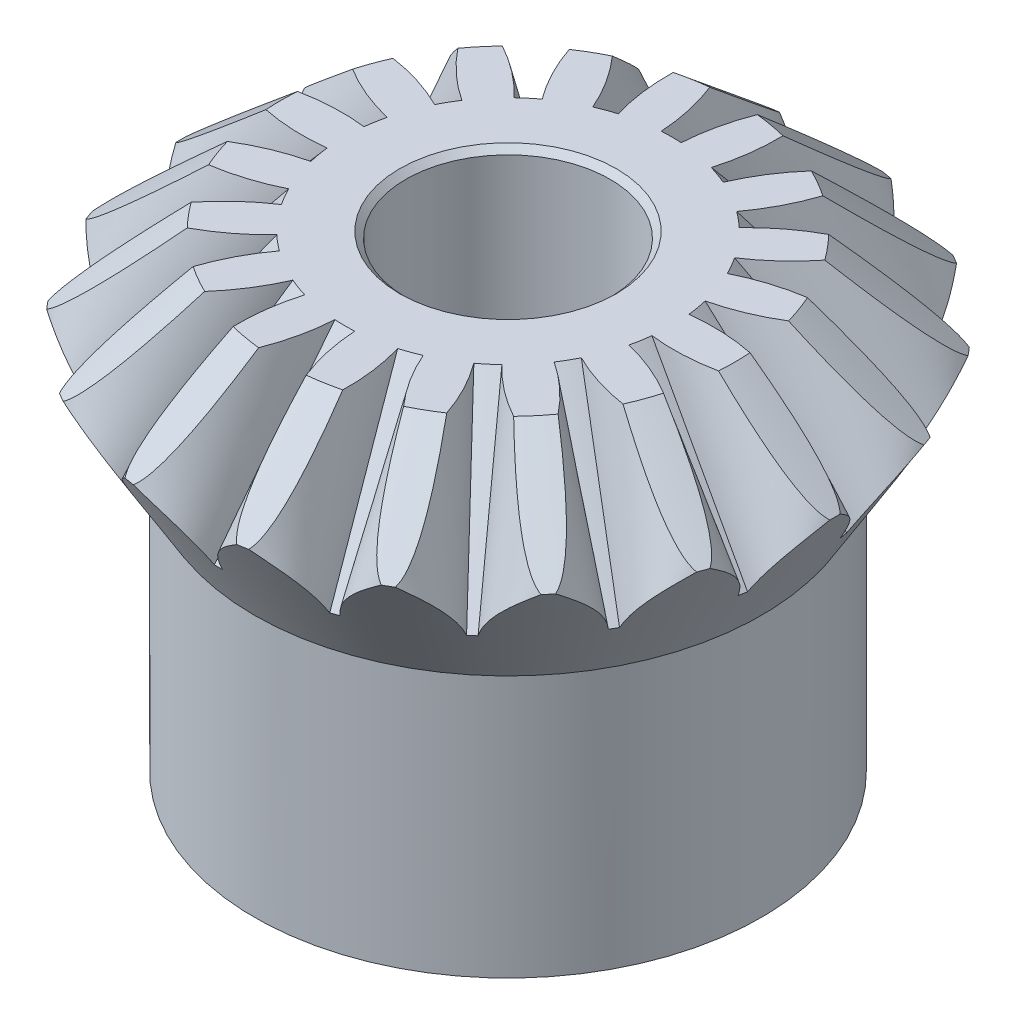
from build123d import *

# Parameters (mm, degrees)
CUT_EXTRUDE1_DEPTH      = 11.216863871
CUT_EXTRUDE1_DEPTH_BACK = 11.216863871
SKETCH4_R               = 1.5875
CIRPATTERN2_COUNT       = 18
CHAMFER1_SIZE           = 0.09525


with BuildPart() as part:
    # Sketch3 → Revolve1 (revolve)
    with BuildSketch(Plane(origin=(0, 0, 0), x_dir=(0, 0, -1), z_dir=(1, 0, 0))):
        Polygon((0, 3.6322), (-3.523397692, 3.6322), (-5.08, 2.326055577), (-3.937, 0.4318), (-3.937, -3.6322), (0, -3.6322), align=None)
    revolve(axis=Axis((0, -3.6322, 0), (0, 1, 0)))

    # Sketch4 → Cut-Extrude1 (cut, two sides: drawn at the far end of the back side and taken through both)
    with BuildSketch(Plane(origin=(0, 3.6322, 0), x_dir=(1, 0, 0), z_dir=(0, 1, 0)).offset(-CUT_EXTRUDE1_DEPTH_BACK)):
        Circle(SKETCH4_R)
    extrude(amount=CUT_EXTRUDE1_DEPTH + CUT_EXTRUDE1_DEPTH_BACK, mode=Mode.SUBTRACT)

    # Sketch5 for Cut-Loft1 → Cut-Loft1 section 0
    with BuildSketch(Plane(origin=(0, 3.6322, 0), x_dir=(1, 0, 0), z_dir=(0, 1, 0))):
        with BuildLine():
            Line((-3.323732568, -5.517013411), (3.323732568, -5.517013411))
            # circular arc as an exact rational Bezier (weights 1, cos(half-angle), 1)
            Bezier((3.323732568, -5.517013411), (0.336468503, -5.517013411), (0.154620801, -2.535289413), weights=[1, 0.728311174, 1])
            Bezier((0.154620801, -2.535289413), (0, -2.544719339), (-0.154620801, -2.535289413), weights=[1, 0.998145438, 1])
            Bezier((-0.154620801, -2.535289413), (-0.336468503, -5.517013411), (-3.323732568, -5.517013411), weights=[1, 0.728311174, 1])
        make_face()
    # Sketch7 for Cut-Loft1 → Cut-Loft1 section 1
    with BuildSketch(Plane(origin=(0, 2.326055577, 5.08), x_dir=(1, 0, 0), z_dir=(0, -0.5166367166728313, 0.8562047085747174))):
        with BuildLine():
            Line((-0.063247791, -1.12823362), (0.063247791, -1.12823362))
            Bezier((0.063247791, -1.12823362), (0.268469842, 0.098125002), (1.511881102, 0.098125002), weights=[1, 0.76323247, 1])
            Line((1.511881102, 0.098125002), (-1.511881102, 0.098125002))
            Bezier((-1.511881102, 0.098125002), (-0.268469842, 0.098125002), (-0.063247791, -1.12823362), weights=[1, 0.76323247, 1])
        make_face()
    cut_loft1 = loft(mode=Mode.SUBTRACT)

    # CirPattern2: Cut-Loft1 ×18 about axis
    cirpattern2_axis = Axis((0, 3.6322, 0), (0, -1, 0))
    for i in range(1, CIRPATTERN2_COUNT):
        add(cut_loft1.rotate(cirpattern2_axis, i * 360 / CIRPATTERN2_COUNT), mode=Mode.SUBTRACT)

    # Chamfer1
    chamfer1_edges = [part.edges().sort_by_distance(p)[0] for p in [
        (-1.5875, -3.6322, 0),
        (-1.5875, 3.6322, 0),
    ]]
    chamfer(chamfer1_edges, length=CHAMFER1_SIZE)


solid = part.part
